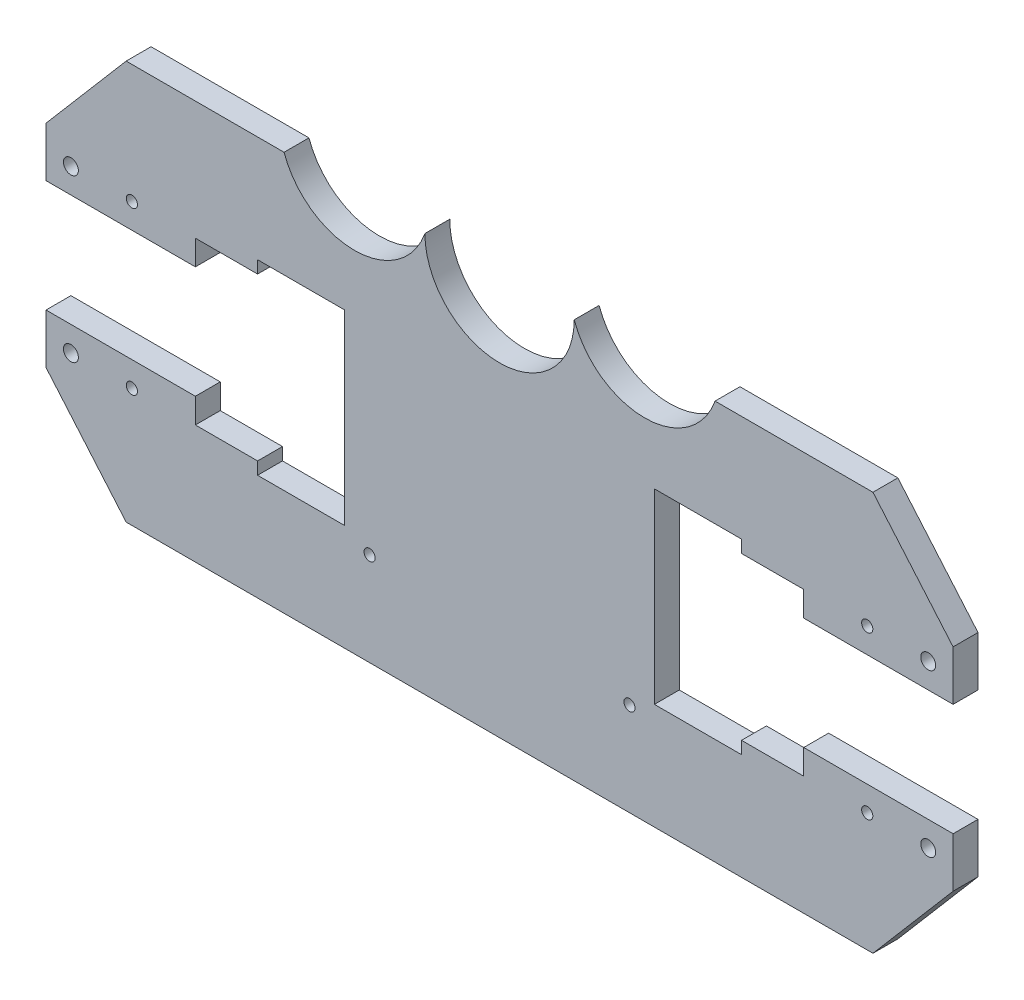
from build123d import *

# Parameters (mm, degrees)
BOSS_EXTRU_1_DEPTH           = 10
ENL_V_MAT_EXTRU_1_DEPTH      = 10
ENL_V_MAT_EXTRU_2_DEPTH      = 200.321047559
ENL_V_MAT_EXTRU_2_DEPTH_BACK = 10
ESQUISSE10_R                 = 2.25
ESQUISSE10_R_2               = 3
ENL_V_MAT_EXTRU_3_DEPTH      = 10
ESQUISSE15_R                 = 2.25
ENL_V_MAT_EXTRU_4_DEPTH      = 10


with BuildPart() as part:
    # Esquisse3 → Boss.-Extru.1 (new body)
    with BuildSketch(Plane.XY):
        Polygon((-150, 80.2), (-182.2, 42.5), (-182.2, -42.5), (-150, -80.2), (150, -80.2), (182.2, -42.5), (182.2, 42.5), (150, 80.2), align=None)
    extrude(amount=BOSS_EXTRU_1_DEPTH)

    # Esquisse4 → Enlèv. mat.-Extru.1 (cut)
    with BuildSketch(Plane.XY.offset(10)):
        Polygon((-97.2, 32.5), (-122.2, 32.5), (-122.2, 22.5), (-182.2, 22.5), (-182.2, -22.5), (-122.2, -22.5), (-122.2, -32.5), (-97.2, -32.5), (-97.2, -37.5), (-62.2, -37.5), (-62.2, 37.5), (-97.2, 37.5), align=None)
        Polygon((122.2, 22.5), (122.2, 32.5), (97.2, 32.5), (97.2, 37.5), (62.2, 37.5), (62.2, -37.5), (97.2, -37.5), (97.2, -32.5), (122.2, -32.5), (122.2, -22.5), (182.2, -22.5), (182.2, 22.5), align=None)
    extrude(amount=-ENL_V_MAT_EXTRU_1_DEPTH, mode=Mode.SUBTRACT)

    # Esquisse5 → Enlèv. mat.-Extru.2 (cut, two sides: drawn at the far end of the back side and taken through both)
    with BuildSketch(Plane.XY.offset(10).offset(-ENL_V_MAT_EXTRU_2_DEPTH_BACK)):
        with BuildLine():
            Line((298.563951853, 679.813566151), (86.568542495, 80.2))
            ThreePointArc((86.568542495, 80.2), (58.284271247, 60.2), (30, 80.2))
            ThreePointArc((30, 80.2), (0, 50.2), (-30, 80.2))
            ThreePointArc((-30, 80.2), (-58.284271247, 60.2), (-86.568542495, 80.2))
            Line((-86.568542495, 80.2), (-298.563951853, 679.813566151))
            Line((-298.563951853, 679.813566151), (-298.563951853, 1951.7860223))
            Line((-298.563951853, 1951.7860223), (298.563951853, 1951.7860223))
            Line((298.563951853, 1951.7860223), (298.563951853, 679.813566151))
        make_face()
    extrude(amount=ENL_V_MAT_EXTRU_2_DEPTH + ENL_V_MAT_EXTRU_2_DEPTH_BACK, mode=Mode.SUBTRACT)

    # Esquisse10 → Enlèv. mat.-Extru.3 (cut)
    with BuildSketch(Plane.XY.offset(10)):
        with Locations((-147.7, 32.5)):
            Circle(ESQUISSE10_R)
        with Locations((-172.2, 32.5)):
            Circle(ESQUISSE10_R_2)
        with Locations((-172.2, -32.5)):
            Circle(ESQUISSE10_R_2)
        with Locations((-147.7, -32.5)):
            Circle(ESQUISSE10_R)
        with Locations((172.2, 32.5)):
            Circle(ESQUISSE10_R_2)
        with Locations((147.7, 32.5)):
            Circle(ESQUISSE10_R)
        with Locations((172.2, -32.5)):
            Circle(ESQUISSE10_R_2)
        with Locations((147.7, -32.5)):
            Circle(ESQUISSE10_R)
    extrude(amount=-ENL_V_MAT_EXTRU_3_DEPTH, mode=Mode.SUBTRACT)

    # Esquisse15 → Enlèv. mat.-Extru.4 (cut)
    with BuildSketch(Plane.XY.offset(10)):
        with Locations((-52.2, -42.7)):
            Circle(ESQUISSE15_R)
        with Locations((52.2, -42.7)):
            Circle(ESQUISSE15_R)
    extrude(amount=-ENL_V_MAT_EXTRU_4_DEPTH, mode=Mode.SUBTRACT)


solid = part.part
